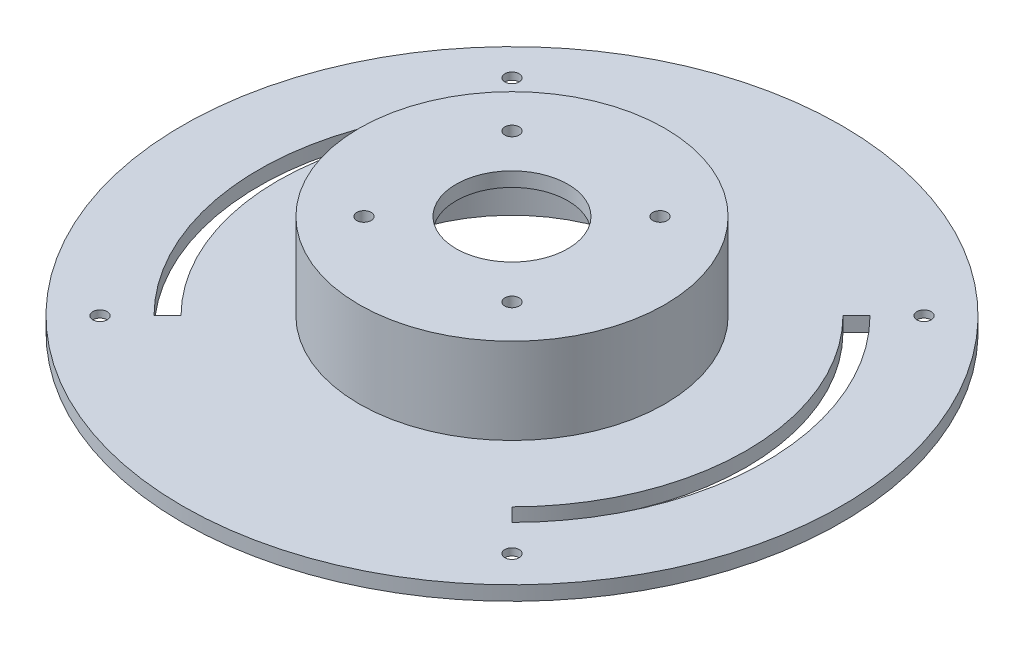
from build123d import *

# Parameters (mm, degrees)
SKETCH1_R           = 69
BOSS_EXTRUDE1_DEPTH = 3
SKETCH2_R           = 32
BOSS_EXTRUDE2_DEPTH = 18
SKETCH3_R           = 11.7
SKETCH3_R_2         = 1.5
CUT_EXTRUDE1_DEPTH  = 100.814828558
SKETCH6_R           = 30
CUT_EXTRUDE3_DEPTH  = 18
SKETCH7_R           = 1.5
CUT_EXTRUDE5_DEPTH  = 100.227012451
SKETCH8_R           = 4.05
CUT_EXTRUDE6_DEPTH  = 1.5


with BuildPart() as part:
    # Sketch1 → Boss-Extrude1 (new body)
    with BuildSketch(Plane(origin=(0, 0, 0), x_dir=(1, 0, 0), z_dir=(0, 1, 0))):
        Circle(SKETCH1_R)
    extrude(amount=BOSS_EXTRUDE1_DEPTH)

    # Sketch2 → Boss-Extrude2 (add)
    with BuildSketch(Plane(origin=(0, 3, 0), x_dir=(1, 0, 0), z_dir=(0, 1, 0))):
        Circle(SKETCH2_R)
    extrude(amount=BOSS_EXTRUDE2_DEPTH)

    # Sketch3 → Cut-Extrude1 (cut, through all)
    with BuildSketch(Plane(origin=(0, 21, 0), x_dir=(1, 0, 0), z_dir=(0, 1, 0))):
        Circle(SKETCH3_R)
        with Locations((15.5, 15.5)):
            Circle(SKETCH3_R_2)
        with Locations((-15.5, 15.5)):
            Circle(SKETCH3_R_2)
        with Locations((15.5, -15.5)):
            Circle(SKETCH3_R_2)
        with Locations((-15.5, -15.5)):
            Circle(SKETCH3_R_2)
    extrude(amount=-CUT_EXTRUDE1_DEPTH, mode=Mode.SUBTRACT)

    # Sketch6 → Cut-Extrude3 (cut)
    with BuildSketch(Plane(origin=(0, 0, 0), x_dir=(-1, 0, 0), z_dir=(0, -1, 0))):
        Circle(SKETCH6_R)
    extrude(amount=-CUT_EXTRUDE3_DEPTH, mode=Mode.SUBTRACT)

    # Sketch7 → Cut-Extrude5 (cut, through all)
    with BuildSketch(Plane(origin=(0, 3, 0), x_dir=(1, 0, 0), z_dir=(0, 1, 0))):
        with Locations((43.133513652, 43.133513652)):
            Circle(SKETCH7_R)
        with Locations((43.133513652, -43.133513652)):
            Circle(SKETCH7_R)
        with Locations((-43.133513652, -43.133513652)):
            Circle(SKETCH7_R)
        with Locations((-43.133513652, 43.133513652)):
            Circle(SKETCH7_R)
        with BuildLine():
            Line((34.648232278, 34.648232278), (37.476659403, 37.476659403))
            ThreePointArc((37.476659403, 37.476659403), (53, 0), (37.476659403, -37.476659403))
            Line((37.476659403, -37.476659403), (34.648232278, -34.648232278))
            ThreePointArc((34.648232278, -34.648232278), (49, 0), (34.648232278, 34.648232278))
        make_face()
        with BuildLine():
            Line((-37.476659403, -37.476659403), (-34.648232278, -34.648232278))
            ThreePointArc((-34.648232278, -34.648232278), (-49, 0), (-34.648232278, 34.648232278))
            Line((-34.648232278, 34.648232278), (-37.476659403, 37.476659403))
            ThreePointArc((-37.476659403, 37.476659403), (-53, 0), (-37.476659403, -37.476659403))
        make_face()
    extrude(amount=-CUT_EXTRUDE5_DEPTH, mode=Mode.SUBTRACT)

    # Sketch8 → Cut-Extrude6 (cut)
    with BuildSketch(Plane.XZ):
        with Locations((-43.133513652, 43.133513652)):
            Circle(SKETCH8_R)
        with Locations((43.133513652, 43.133513652)):
            Circle(SKETCH8_R)
        with Locations((43.133513652, -43.133513652)):
            Circle(SKETCH8_R)
        with Locations((-43.133513652, -43.133513652)):
            Circle(SKETCH8_R)
    extrude(amount=-CUT_EXTRUDE6_DEPTH, mode=Mode.SUBTRACT)


solid = part.part
